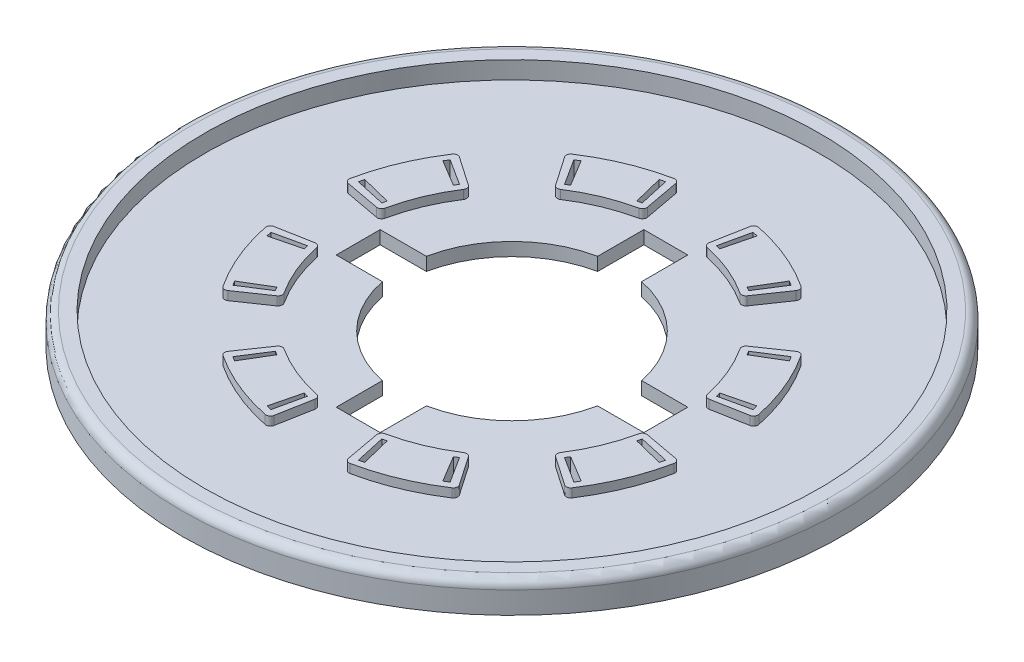
from build123d import *

# Parameters (mm, degrees)
CROQUIS1_R              = 75
SALIENTE_EXTRUIR1_DEPTH = 3
CROQUIS3_R              = 75
CROQUIS3_R_2            = 70
SALIENTE_EXTRUIR2_DEPTH = 4
CROQUIS2_R              = 3.75
CORTAR_EXTRUIR1_DEPTH   = 2
CROQUIS4_R              = 25
CORTAR_EXTRUIR2_DEPTH   = 6
SALIENTE_EXTRUIR4_DEPTH = 2
CORTAR_EXTRUIR3_DEPTH   = 11
REDONDEO1_R             = 2
CROQUIS11_W             = 10
CROQUIS11_H             = 30
CROQUIS11_W_2           = 30
CROQUIS11_H_2           = 10
CORTAR_EXTRUIR4_DEPTH   = 10


with BuildPart() as part:
    # Croquis1 → Saliente-Extruir1 (new body)
    with BuildSketch(Plane(origin=(0, 0, 0), x_dir=(1, 0, 0), z_dir=(0, 1, 0))):
        Circle(CROQUIS1_R)
    extrude(amount=SALIENTE_EXTRUIR1_DEPTH)

    # Croquis3 → Saliente-Extruir2 (add)
    with BuildSketch(Plane(origin=(0, 3, 0), x_dir=(1, 0, 0), z_dir=(0, 1, 0))):
        Circle(CROQUIS3_R)
        Circle(CROQUIS3_R_2, mode=Mode.SUBTRACT)
    extrude(amount=SALIENTE_EXTRUIR2_DEPTH)

    # Croquis2 → Cortar-Extruir1 (cut)
    with BuildSketch(Plane.XZ):
        with Locations((-55.432771951, 22.961005942)):
            Circle(CROQUIS2_R)
        with Locations((-22.961005942, 55.432771951)):
            Circle(CROQUIS2_R)
        with Locations((22.961005942, 55.432771951)):
            Circle(CROQUIS2_R)
        with Locations((55.432771951, 22.961005942)):
            Circle(CROQUIS2_R)
        with Locations((55.432771951, -22.961005942)):
            Circle(CROQUIS2_R)
        with Locations((22.961005942, -55.432771951)):
            Circle(CROQUIS2_R)
        with Locations((-22.961005942, -55.432771951)):
            Circle(CROQUIS2_R)
        with Locations((-55.432771951, -22.961005942)):
            Circle(CROQUIS2_R)
    extrude(amount=-CORTAR_EXTRUIR1_DEPTH, mode=Mode.SUBTRACT)

    # Croquis4 → Cortar-Extruir2 (cut)
    with BuildSketch(Plane.XZ):
        Circle(CROQUIS4_R)
    extrude(amount=-CORTAR_EXTRUIR2_DEPTH, mode=Mode.SUBTRACT)

    # Croquis8 → Saliente-Extruir4 (add)
    with BuildSketch(Plane(origin=(0, 3, 0), x_dir=(1, 0, 0), z_dir=(0, 1, 0))):
        with BuildLine():
            Line((-45.710779346, -8.471992187), (-37.842542242, -7.013700637))
            ThreePointArc((-37.842542242, -7.013700637), (-37.104652096, -7.165542325), (-36.682116932, -7.789242414))
            ThreePointArc((-36.682116932, -7.789242414), (-34.645482469, -14.350628714), (-31.445999762, -20.4303475))
            ThreePointArc((-31.445999762, -20.4303475), (-31.303754679, -21.170147542), (-31.718153519, -21.799282955))
            Line((-31.718153519, -21.799282955), (-38.313005174, -26.331798923))
            ThreePointArc((-38.313005174, -26.331798923), (-39.072209645, -26.488911157), (-39.715527786, -26.056224836))
            ThreePointArc((-39.715527786, -26.056224836), (-43.884277794, -18.177463037), (-46.507652289, -9.658585742))
            ThreePointArc((-46.507652289, -9.658585742), (-46.358713101, -8.897735691), (-45.710779346, -8.471992187))
        make_face()
        with BuildLine():
            Line((-38.313005174, 26.331798923), (-31.718153519, 21.799282955))
            ThreePointArc((-31.718153519, 21.799282955), (-31.303754679, 21.170147542), (-31.445999762, 20.4303475))
            ThreePointArc((-31.445999762, 20.4303475), (-34.645482469, 14.350628714), (-36.682116932, 7.789242414))
            ThreePointArc((-36.682116932, 7.789242414), (-37.104652096, 7.165542325), (-37.842542242, 7.013700637))
            Line((-37.842542242, 7.013700637), (-45.710779346, 8.471992187))
            ThreePointArc((-45.710779346, 8.471992187), (-46.358713101, 8.897735691), (-46.507652289, 9.658585742))
            ThreePointArc((-46.507652289, 9.658585742), (-43.884277794, 18.177463037), (-39.715527786, 26.056224836))
            ThreePointArc((-39.715527786, 26.056224836), (-39.072209645, 26.488911157), (-38.313005174, 26.331798923))
        make_face()
        with BuildLine():
            Line((-8.471992187, 45.710779346), (-7.013700637, 37.842542242))
            ThreePointArc((-7.013700637, 37.842542242), (-7.165542325, 37.104652096), (-7.789242414, 36.682116932))
            ThreePointArc((-7.789242414, 36.682116932), (-14.350628714, 34.645482469), (-20.4303475, 31.445999762))
            ThreePointArc((-20.4303475, 31.445999762), (-21.170147542, 31.303754679), (-21.799282955, 31.718153519))
            Line((-21.799282955, 31.718153519), (-26.331798923, 38.313005174))
            ThreePointArc((-26.331798923, 38.313005174), (-26.488911157, 39.072209645), (-26.056224836, 39.715527786))
            ThreePointArc((-26.056224836, 39.715527786), (-18.177463037, 43.884277794), (-9.658585742, 46.507652289))
            ThreePointArc((-9.658585742, 46.507652289), (-8.897735691, 46.358713101), (-8.471992187, 45.710779346))
        make_face()
        with BuildLine():
            Line((26.331798923, 38.313005174), (21.799282955, 31.718153519))
            ThreePointArc((21.799282955, 31.718153519), (21.170147542, 31.303754679), (20.4303475, 31.445999762))
            ThreePointArc((20.4303475, 31.445999762), (14.350628714, 34.645482469), (7.789242414, 36.682116932))
            ThreePointArc((7.789242414, 36.682116932), (7.165542325, 37.104652096), (7.013700637, 37.842542242))
            Line((7.013700637, 37.842542242), (8.471992187, 45.710779346))
            ThreePointArc((8.471992187, 45.710779346), (8.897735691, 46.358713101), (9.658585742, 46.507652289))
            ThreePointArc((9.658585742, 46.507652289), (18.177463037, 43.884277794), (26.056224836, 39.715527786))
            ThreePointArc((26.056224836, 39.715527786), (26.488911157, 39.072209645), (26.331798923, 38.313005174))
        make_face()
        with BuildLine():
            Line((45.710779346, 8.471992187), (37.842542242, 7.013700637))
            ThreePointArc((37.842542242, 7.013700637), (37.104652096, 7.165542325), (36.682116932, 7.789242414))
            ThreePointArc((36.682116932, 7.789242414), (34.645482469, 14.350628714), (31.445999762, 20.4303475))
            ThreePointArc((31.445999762, 20.4303475), (31.303754679, 21.170147542), (31.718153519, 21.799282955))
            Line((31.718153519, 21.799282955), (38.313005174, 26.331798923))
            ThreePointArc((38.313005174, 26.331798923), (39.072209645, 26.488911157), (39.715527786, 26.056224836))
            ThreePointArc((39.715527786, 26.056224836), (43.884277794, 18.177463037), (46.507652289, 9.658585742))
            ThreePointArc((46.507652289, 9.658585742), (46.358713101, 8.897735691), (45.710779346, 8.471992187))
        make_face()
        with BuildLine():
            Line((38.313005174, -26.331798923), (31.718153519, -21.799282955))
            ThreePointArc((31.718153519, -21.799282955), (31.303754679, -21.170147542), (31.445999762, -20.4303475))
            ThreePointArc((31.445999762, -20.4303475), (34.645482469, -14.350628714), (36.682116932, -7.789242414))
            ThreePointArc((36.682116932, -7.789242414), (37.104652096, -7.165542325), (37.842542242, -7.013700637))
            Line((37.842542242, -7.013700637), (45.710779346, -8.471992187))
            ThreePointArc((45.710779346, -8.471992187), (46.358713101, -8.897735691), (46.507652289, -9.658585742))
            ThreePointArc((46.507652289, -9.658585742), (43.884277794, -18.177463037), (39.715527786, -26.056224836))
            ThreePointArc((39.715527786, -26.056224836), (39.072209645, -26.488911157), (38.313005174, -26.331798923))
        make_face()
        with BuildLine():
            Line((8.471992187, -45.710779346), (7.013700637, -37.842542242))
            ThreePointArc((7.013700637, -37.842542242), (7.165542325, -37.104652096), (7.789242414, -36.682116932))
            ThreePointArc((7.789242414, -36.682116932), (14.350628714, -34.645482469), (20.4303475, -31.445999762))
            ThreePointArc((20.4303475, -31.445999762), (21.170147542, -31.303754679), (21.799282955, -31.718153519))
            Line((21.799282955, -31.718153519), (26.331798923, -38.313005174))
            ThreePointArc((26.331798923, -38.313005174), (26.488911157, -39.072209645), (26.056224836, -39.715527786))
            ThreePointArc((26.056224836, -39.715527786), (18.177463037, -43.884277794), (9.658585742, -46.507652289))
            ThreePointArc((9.658585742, -46.507652289), (8.897735691, -46.358713101), (8.471992187, -45.710779346))
        make_face()
        with BuildLine():
            Line((-26.331798923, -38.313005174), (-21.799282955, -31.718153519))
            ThreePointArc((-21.799282955, -31.718153519), (-21.170147542, -31.303754679), (-20.4303475, -31.445999762))
            ThreePointArc((-20.4303475, -31.445999762), (-14.350628714, -34.645482469), (-7.789242414, -36.682116932))
            ThreePointArc((-7.789242414, -36.682116932), (-7.165542325, -37.104652096), (-7.013700637, -37.842542242))
            Line((-7.013700637, -37.842542242), (-8.471992187, -45.710779346))
            ThreePointArc((-8.471992187, -45.710779346), (-8.897735691, -46.358713101), (-9.658585742, -46.507652289))
            ThreePointArc((-9.658585742, -46.507652289), (-18.177463037, -43.884277794), (-26.056224836, -39.715527786))
            ThreePointArc((-26.056224836, -39.715527786), (-26.488911157, -39.072209645), (-26.331798923, -38.313005174))
        make_face()
    extrude(amount=SALIENTE_EXTRUIR4_DEPTH)

    # Croquis10 → Cortar-Extruir3 (cut)
    with BuildSketch(Plane(origin=(0, 5, 0), x_dir=(1, 0, 0), z_dir=(0, 1, 0))):
        with BuildLine():
            Line((-44.909616328, -9.956222241), (-38.075544278, -8.441144944))
            ThreePointArc((-38.075544278, -8.441144944), (-37.96179108, -8.938815246), (-37.841533325, -9.434953928))
            Line((-37.841533325, -9.434953928), (-44.633603409, -11.128407198))
            ThreePointArc((-44.633603409, -11.128407198), (-44.775445889, -10.543217982), (-44.909616328, -9.956222241))
        make_face()
        with BuildLine():
            Line((-39.429695832, 23.691751446), (-33.429524727, 20.086484921))
            ThreePointArc((-33.429524727, 20.086484921), (-33.163736775, 20.522343022), (-32.892266387, 20.954684726))
            Line((-32.892266387, 20.954684726), (-38.796006507, 24.715781984))
            ThreePointArc((-38.796006507, 24.715781984), (-39.11620235, 24.205840488), (-39.429695832, 23.691751446))
        make_face()
        with BuildLine():
            Line((-38.796006507, -24.715781984), (-32.892266387, -20.954684726))
            ThreePointArc((-32.892266387, -20.954684726), (-33.163736775, -20.522343022), (-33.429524727, -20.086484921))
            Line((-33.429524727, -20.086484921), (-39.429695832, -23.691751446))
            ThreePointArc((-39.429695832, -23.691751446), (-39.11620235, -24.205840488), (-38.796006507, -24.715781984))
        make_face()
        with BuildLine():
            Line((-44.909616328, 9.956222241), (-38.075544278, 8.441144944))
            ThreePointArc((-38.075544278, 8.441144944), (-37.96179108, 8.938815246), (-37.841533325, 9.434953928))
            Line((-37.841533325, 9.434953928), (-44.633603409, 11.128407198))
            ThreePointArc((-44.633603409, 11.128407198), (-44.775445889, 10.543217982), (-44.909616328, 9.956222241))
        make_face()
        with BuildLine():
            Line((-11.128407198, 44.633603409), (-9.434953928, 37.841533325))
            ThreePointArc((-9.434953928, 37.841533325), (-8.938815246, 37.96179108), (-8.441144944, 38.075544278))
            Line((-8.441144944, 38.075544278), (-9.956222241, 44.909616328))
            ThreePointArc((-9.956222241, 44.909616328), (-10.543217982, 44.775445889), (-11.128407198, 44.633603409))
        make_face()
        with BuildLine():
            Line((-24.715781984, 38.796006507), (-20.954684726, 32.892266387))
            ThreePointArc((-20.954684726, 32.892266387), (-20.522343022, 33.163736775), (-20.086484921, 33.429524727))
            Line((-20.086484921, 33.429524727), (-23.691751446, 39.429695832))
            ThreePointArc((-23.691751446, 39.429695832), (-24.205840488, 39.11620235), (-24.715781984, 38.796006507))
        make_face()
        with BuildLine():
            Line((23.691751446, 39.429695832), (20.086484921, 33.429524727))
            ThreePointArc((20.086484921, 33.429524727), (20.522343022, 33.163736775), (20.954684726, 32.892266387))
            Line((20.954684726, 32.892266387), (24.715781984, 38.796006507))
            ThreePointArc((24.715781984, 38.796006507), (24.205840488, 39.11620235), (23.691751446, 39.429695832))
        make_face()
        with BuildLine():
            Line((9.956222241, 44.909616328), (8.441144944, 38.075544278))
            ThreePointArc((8.441144944, 38.075544278), (8.938815246, 37.96179108), (9.434953928, 37.841533325))
            Line((9.434953928, 37.841533325), (11.128407198, 44.633603409))
            ThreePointArc((11.128407198, 44.633603409), (10.543217982, 44.775445889), (9.956222241, 44.909616328))
        make_face()
        with BuildLine():
            Line((44.633603409, 11.128407198), (37.841533325, 9.434953928))
            ThreePointArc((37.841533325, 9.434953928), (37.96179108, 8.938815246), (38.075544278, 8.441144944))
            Line((38.075544278, 8.441144944), (44.909616328, 9.956222241))
            ThreePointArc((44.909616328, 9.956222241), (44.775445889, 10.543217982), (44.633603409, 11.128407198))
        make_face()
        with BuildLine():
            Line((38.796006507, 24.715781984), (32.892266387, 20.954684726))
            ThreePointArc((32.892266387, 20.954684726), (33.163736775, 20.522343022), (33.429524727, 20.086484921))
            Line((33.429524727, 20.086484921), (39.429695832, 23.691751446))
            ThreePointArc((39.429695832, 23.691751446), (39.11620235, 24.205840488), (38.796006507, 24.715781984))
        make_face()
        with BuildLine():
            Line((39.429695832, -23.691751446), (33.429524727, -20.086484921))
            ThreePointArc((33.429524727, -20.086484921), (33.163736775, -20.522343022), (32.892266387, -20.954684726))
            Line((32.892266387, -20.954684726), (38.796006507, -24.715781984))
            ThreePointArc((38.796006507, -24.715781984), (39.11620235, -24.205840488), (39.429695832, -23.691751446))
        make_face()
        with BuildLine():
            Line((44.909616328, -9.956222241), (38.075544278, -8.441144944))
            ThreePointArc((38.075544278, -8.441144944), (37.96179108, -8.938815246), (37.841533325, -9.434953928))
            Line((37.841533325, -9.434953928), (44.633603409, -11.128407198))
            ThreePointArc((44.633603409, -11.128407198), (44.775445889, -10.543217982), (44.909616328, -9.956222241))
        make_face()
        with BuildLine():
            Line((11.128407198, -44.633603409), (9.434953928, -37.841533325))
            ThreePointArc((9.434953928, -37.841533325), (8.938815246, -37.96179108), (8.441144944, -38.075544278))
            Line((8.441144944, -38.075544278), (9.956222241, -44.909616328))
            ThreePointArc((9.956222241, -44.909616328), (10.543217982, -44.775445889), (11.128407198, -44.633603409))
        make_face()
        with BuildLine():
            Line((24.715781984, -38.796006507), (20.954684726, -32.892266387))
            ThreePointArc((20.954684726, -32.892266387), (20.522343022, -33.163736775), (20.086484921, -33.429524727))
            Line((20.086484921, -33.429524727), (23.691751446, -39.429695832))
            ThreePointArc((23.691751446, -39.429695832), (24.205840488, -39.11620235), (24.715781984, -38.796006507))
        make_face()
        with BuildLine():
            Line((-23.691751446, -39.429695832), (-20.086484921, -33.429524727))
            ThreePointArc((-20.086484921, -33.429524727), (-20.522343022, -33.163736775), (-20.954684726, -32.892266387))
            Line((-20.954684726, -32.892266387), (-24.715781984, -38.796006507))
            ThreePointArc((-24.715781984, -38.796006507), (-24.205840488, -39.11620235), (-23.691751446, -39.429695832))
        make_face()
        with BuildLine():
            Line((-9.956222241, -44.909616328), (-8.441144944, -38.075544278))
            ThreePointArc((-8.441144944, -38.075544278), (-8.938815246, -37.96179108), (-9.434953928, -37.841533325))
            Line((-9.434953928, -37.841533325), (-11.128407198, -44.633603409))
            ThreePointArc((-11.128407198, -44.633603409), (-10.543217982, -44.775445889), (-9.956222241, -44.909616328))
        make_face()
    extrude(amount=-CORTAR_EXTRUIR3_DEPTH, mode=Mode.SUBTRACT)

    # Redondeo1
    redondeo1_edges = [part.edges().sort_by_distance(p)[0] for p in [
        (-75, 7, 0),
    ]]
    fillet(redondeo1_edges, radius=REDONDEO1_R)

    # Croquis11 → Cortar-Extruir4 (cut)
    with BuildSketch(Plane(origin=(0, 3, 0), x_dir=(1, 0, 0), z_dir=(0, 1, 0))):
        with Locations((0, -20)):
            Rectangle(CROQUIS11_W, CROQUIS11_H)
        with Locations((-20, 0)):
            Rectangle(CROQUIS11_W_2, CROQUIS11_H_2)
        with Locations((20, 0)):
            Rectangle(CROQUIS11_W_2, CROQUIS11_H_2)
        with Locations((0, 20)):
            Rectangle(CROQUIS11_W, CROQUIS11_H)
    extrude(amount=-CORTAR_EXTRUIR4_DEPTH, mode=Mode.SUBTRACT)


solid = part.part
